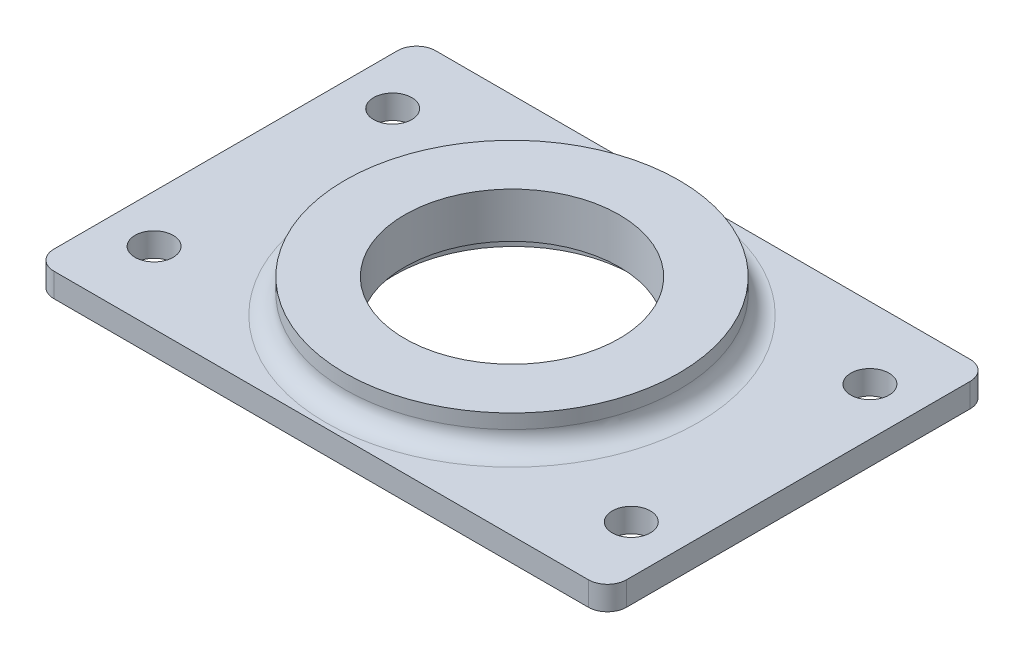
from build123d import *

# Parameters (mm, degrees)
SKETCH1_W           = 76.2
SKETCH1_H           = 50.8
SKETCH1_R           = 14.2748
BOSS_EXTRUDE1_DEPTH = 3.175
SKETCH2_R           = 22.225
BOSS_EXTRUDE2_DEPTH = 4.445
SKETCH3_R           = 14.2748
CUT_EXTRUDE1_DEPTH  = 92.688810795
SKETCH4_R           = 15.8623
CUT_EXTRUDE2_DEPTH  = 1.6002
FILLET1_R           = 2.54
FILLET2_R           = 2.54
SKETCH5_R           = 2.54
CUT_EXTRUDE3_DEPTH  = 92.688810795


with BuildPart() as part:
    # Sketch1 → Boss-Extrude1 (new body)
    with BuildSketch(Plane(origin=(0, 0, 0), x_dir=(1, 0, 0), z_dir=(0, 1, 0))):
        with Locations((38.1, 25.4)):
            Rectangle(SKETCH1_W, SKETCH1_H)
        with Locations((38.1, 25.4)):
            Circle(SKETCH1_R, mode=Mode.SUBTRACT)
    extrude(amount=BOSS_EXTRUDE1_DEPTH)

    # Sketch2 → Boss-Extrude2 (add)
    with BuildSketch(Plane(origin=(0, 3.175, 0), x_dir=(1, 0, 0), z_dir=(0, 1, 0))):
        with Locations((38.1, 25.4)):
            Circle(SKETCH2_R)
    extrude(amount=BOSS_EXTRUDE2_DEPTH)

    # Sketch3 → Cut-Extrude1 (cut, through all)
    with BuildSketch(Plane.XZ.offset(-3.175)):
        with Locations((38.1, -25.4)):
            Circle(SKETCH3_R)
    extrude(amount=-CUT_EXTRUDE1_DEPTH, mode=Mode.SUBTRACT)

    # Sketch4 → Cut-Extrude2 (cut)
    with BuildSketch(Plane(origin=(0, 0, 0), x_dir=(-1, 0, 0), z_dir=(0, -1, 0))):
        with Locations((-38.332507849, 25.4)):
            Circle(SKETCH4_R)
    extrude(amount=-CUT_EXTRUDE2_DEPTH, mode=Mode.SUBTRACT)

    # Fillet1
    fillet1_edges = [part.edges().sort_by_distance(p)[0] for p in [
        (15.875, 3.175, -25.4),
    ]]
    fillet(fillet1_edges, radius=FILLET1_R)

    # Fillet2
    fillet2_edges = [part.edges().sort_by_distance(p)[0] for p in [
        (0, 1.5875, -50.8),
        (76.2, 1.5875, -50.8),
        (0, 1.5875, 0),
        (76.2, 1.5875, 0),
    ]]
    fillet(fillet2_edges, radius=FILLET2_R)

    # Sketch5 → Cut-Extrude3 (cut, through all)
    with BuildSketch(Plane(origin=(0, 3.175, 0), x_dir=(1, 0, 0), z_dir=(0, 1, 0))):
        with Locations((69.85, 41.275)):
            Circle(SKETCH5_R)
        with Locations((69.85, 9.525)):
            Circle(SKETCH5_R)
        with Locations((6.35, 9.525)):
            Circle(SKETCH5_R)
        with Locations((6.35, 41.275)):
            Circle(SKETCH5_R)
    extrude(amount=-CUT_EXTRUDE3_DEPTH, mode=Mode.SUBTRACT)


solid = part.part
